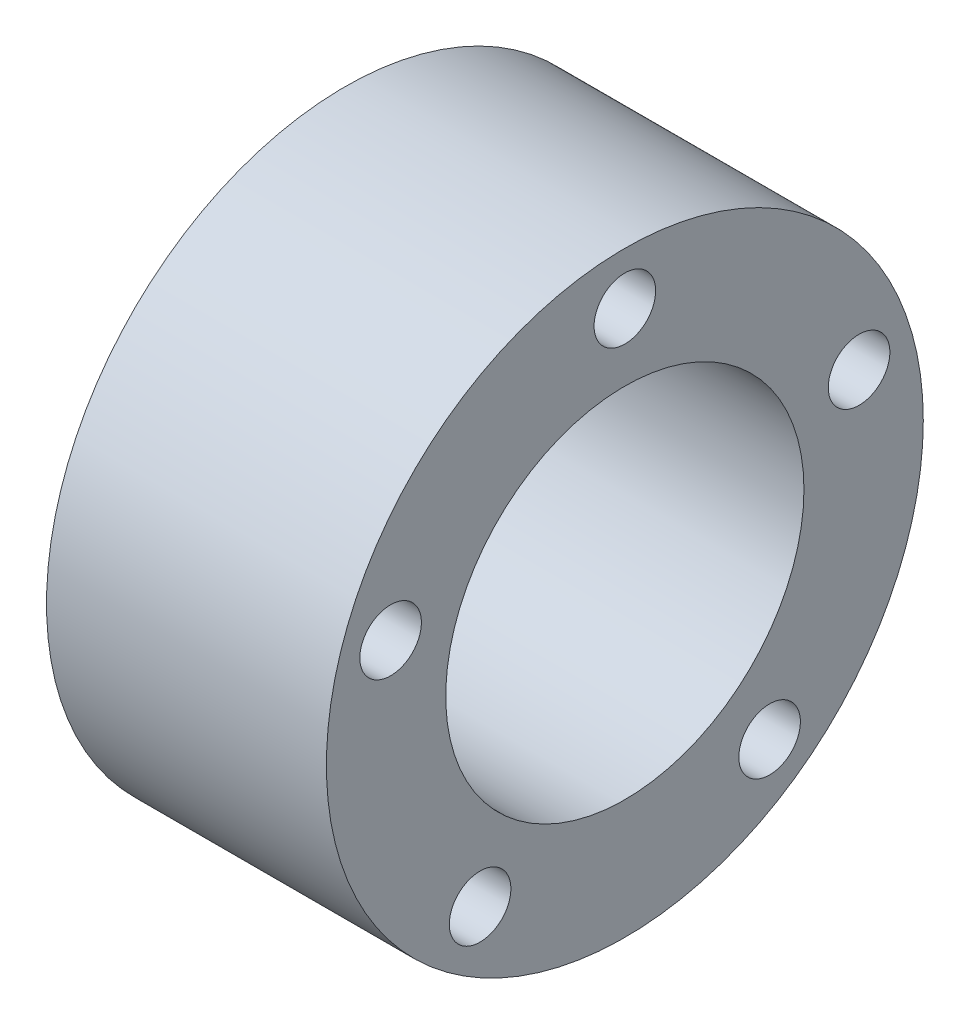
from build123d import *

# Parameters (mm, degrees)
SKETCH1_R           = 13.543461356
SKETCH1_R_2         = 8.128
BOSS_EXTRUDE1_DEPTH = 12.7
SKETCH2_R           = 1.397
CUT_EXTRUDE1_DEPTH  = 23.981311777


with BuildPart() as part:
    # Sketch1 → Boss-Extrude1 (new body)
    with BuildSketch(Plane(origin=(0, 0, 0), x_dir=(0, 0, -1), z_dir=(1, 0, 0))):
        Circle(SKETCH1_R)
        Circle(SKETCH1_R_2, mode=Mode.SUBTRACT)
    extrude(amount=BOSS_EXTRUDE1_DEPTH)

    # Sketch2 → Cut-Extrude1 (cut, through all)
    with BuildSketch(Plane.ZY):
        with Locations((0, 11.176)):
            Circle(SKETCH2_R)
        with Locations((10.629007626, 3.453573929)):
            Circle(SKETCH2_R)
        with Locations((6.56908798, -9.041573929)):
            Circle(SKETCH2_R)
        with Locations((-6.56908798, -9.041573929)):
            Circle(SKETCH2_R)
        with Locations((-10.629007626, 3.453573929)):
            Circle(SKETCH2_R)
    extrude(amount=-CUT_EXTRUDE1_DEPTH, mode=Mode.SUBTRACT)


solid = part.part
